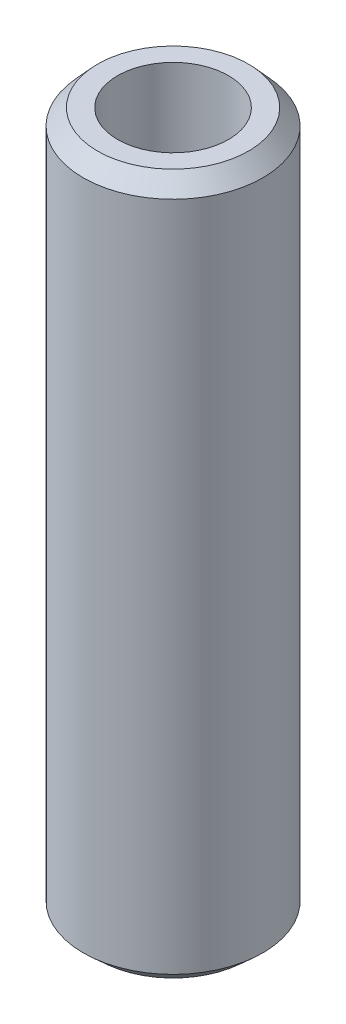
from build123d import *
from OCP.BRepFilletAPI import BRepFilletAPI_MakeChamfer

# Parameters (mm, degrees)
SKETCH1_R           = 20
BOSS_EXTRUDE1_DEPTH = 156.180469807
SKETCH2_R           = 12.334020087
CUT_EXTRUDE1_DEPTH  = 159.720947418
CHAMFER1_SIZE       = 3.536418745
CHAMFER1_SIZE2      = 3.205089348


with BuildPart() as part:
    # Sketch1 → Boss-Extrude1 (new body)
    with BuildSketch(Plane(origin=(0, 0, 0), x_dir=(1, 0, 0), z_dir=(0, 1, 0))):
        Circle(SKETCH1_R)
    extrude(amount=BOSS_EXTRUDE1_DEPTH)

    # Sketch2 → Cut-Extrude1 (cut, through all)
    with BuildSketch(Plane(origin=(0, 0, 0), x_dir=(1, 0, 0), z_dir=(0, 1, 0))):
        Circle(SKETCH2_R)
    extrude(amount=CUT_EXTRUDE1_DEPTH, mode=Mode.SUBTRACT)

    # Chamfer1: one chamfer whose edges measure the first distance from different faces: ONE call of the kernel's chamfer builder (chamfer() names one face for all edges)
    chamfer1_edges_1 = [part.edges().sort_by_distance(p)[0] for p in [
        (-20, 156.180469807, 0),
    ]]
    chamfer1_side_1 = [part.faces().sort_by_distance(p)[0] for p in [
        (-20, 78.090234904, 0),
    ]]
    chamfer1_edges_2 = [part.edges().sort_by_distance(p)[0] for p in [
        (-20, 0, 0),
    ]]
    chamfer1_side_2 = [part.faces().sort_by_distance(p)[0] for p in [
        (-19.434314575, 0, 0),
    ]]
    chamfer1 = BRepFilletAPI_MakeChamfer(part.part.solid().wrapped)
    for e in chamfer1_edges_1:
        chamfer1.Add(CHAMFER1_SIZE, CHAMFER1_SIZE2, e.wrapped, chamfer1_side_1[0].wrapped)  # the first distance lies on this face
    for e in chamfer1_edges_2:
        chamfer1.Add(CHAMFER1_SIZE, CHAMFER1_SIZE2, e.wrapped, chamfer1_side_2[0].wrapped)  # the first distance lies on this face
    add(Compound.cast(chamfer1.Shape()), mode=Mode.REPLACE)


solid = part.part
